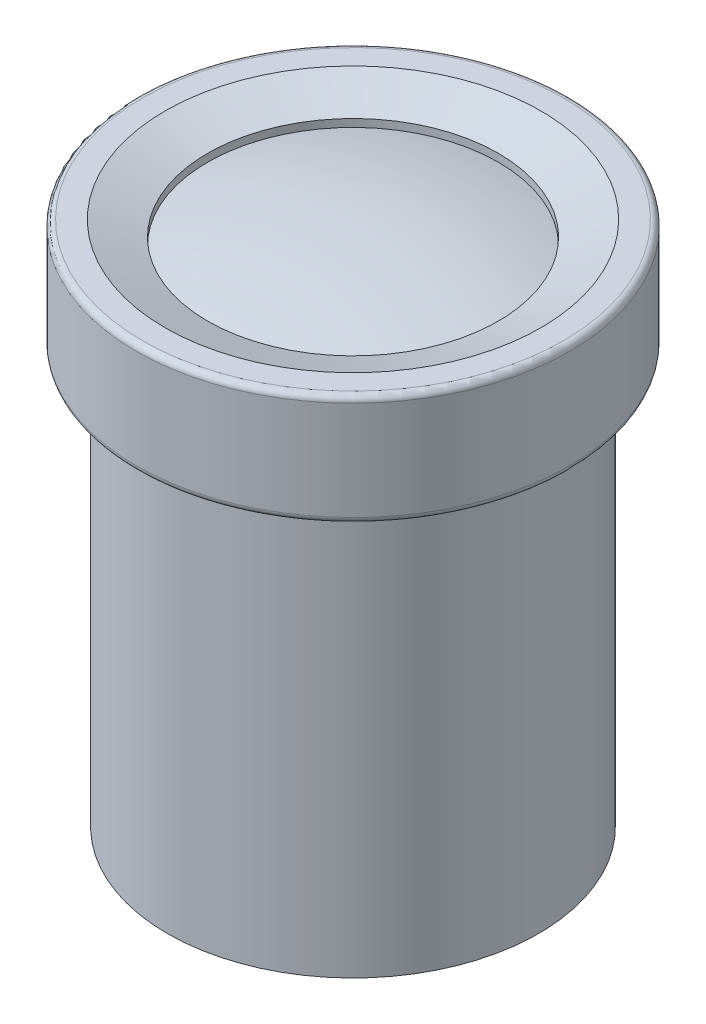
from build123d import *

# Parameters (mm, degrees)
FILLET1_R = 0.2
FILLET2_R = 0.2


with BuildPart() as part:
    # Sketch2 → Revolve1 (revolve)
    with BuildSketch(Plane(origin=(0, 0, 0), x_dir=(0, 0, -1), z_dir=(1, 0, 0))):
        Polygon((-6.07373871, 17), (-4.7, 16.5), (-4.7, 14.5), (-3, 14.5), (-3, 13.61895335), (-1.414766859, 12.818441389), (-1.414766859, 11.5), (-4.7, 11.5), (-4.7, 1), (-2, 1), (-2, 0), (-6, 0), (-6, 13.4), (-7, 13.4), (-7, 17), align=None)
    revolve(axis=Axis((0, 20.636512962, 0), (0, -1, 0)))

    # Fillet1
    fillet1_edges = [part.edges().sort_by_distance(p)[0] for p in [
        (0, 14.5, -3),
    ]]
    fillet(fillet1_edges, radius=FILLET1_R)

    # Fillet2
    fillet2_edges = [part.edges().sort_by_distance(p)[0] for p in [
        (0, 13.4, -7),
        (0, 17, -7),
    ]]
    fillet(fillet2_edges, radius=FILLET2_R)


with BuildPart() as body_2:
    # Sketch3 → Revolve2 (revolve)
    with BuildSketch(Plane(origin=(0, 0, 0), x_dir=(0, 0, -1), z_dir=(1, 0, 0))):
        with BuildLine():
            Line((0, 16.9), (0, 15.9))
            ThreePointArc((0, 15.9), (-2.372366961, 15.736730337), (-4.7, 15.25))
            Line((-4.7, 15.25), (-4.7, 16.25))
            ThreePointArc((-4.7, 16.25), (-2.372366961, 16.736730337), (0, 16.9))
        make_face()
        Polygon((-2, 0), (-2, 1), (-4.7, 1), (-4.7, 2), (0, 2), (0, 0), align=None)
        with BuildLine():
            Line((-3, 14.2), (-3, 13.815689024))
            ThreePointArc((-3, 13.815689024), (-1.534048958, 14.29600477), (0, 14.458514676))
            Line((0, 14.458514676), (0, 15.708094323))
            ThreePointArc((0, 15.708094323), (-1.678864831, 15.309856799), (-3, 14.2))
        make_face()
        with BuildLine():
            Line((-1.414766859, 12.525571159), (-1.414766859, 11.970148919))
            Line((-1.414766859, 11.970148919), (0, 11.970148919))
            Line((0, 11.970148919), (0, 13.380716758))
            ThreePointArc((0, 13.380716758), (-0.82656507, 13.150320013), (-1.414766859, 12.525571159))
        make_face()
    revolve(axis=Axis((0, 16.9, 0), (0, -1, 0)))


solid = Compound([part.part, body_2.part])
